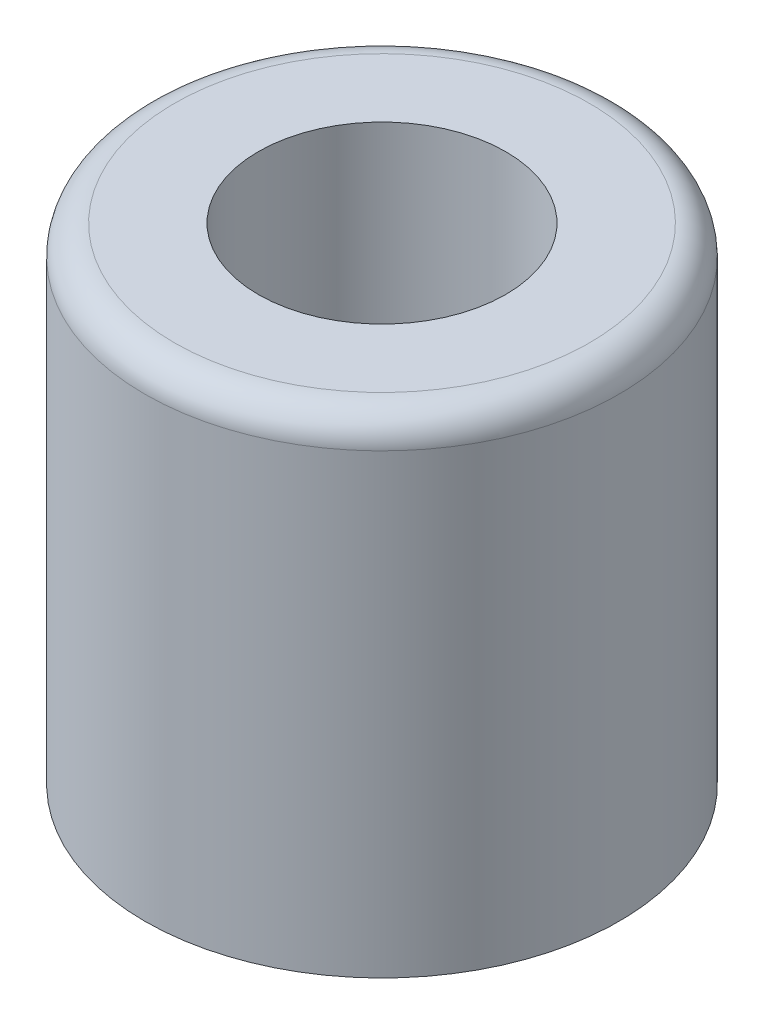
from build123d import *

# Parameters (mm, degrees)
SKETCH1_R      = 4.064
SKETCH1_R_2    = 2.1209
EXTRUDE1_DEPTH = 4.1656
FILLET1_R      = 0.508


with BuildPart() as part:
    # Sketch1 → Extrude1 (new, symmetric)
    with BuildSketch(Plane(origin=(0, 0, 0), x_dir=(1, 0, 0), z_dir=(0, 1, 0))):
        Circle(SKETCH1_R)
        Circle(SKETCH1_R_2, mode=Mode.SUBTRACT)
    extrude(amount=EXTRUDE1_DEPTH, both=True)

    # Fillet1
    fillet1_edges = [part.edges().sort_by_distance(p)[0] for p in [
        (-4.064, 4.1656, 0),
    ]]
    fillet(fillet1_edges, radius=FILLET1_R)


solid = part.part
